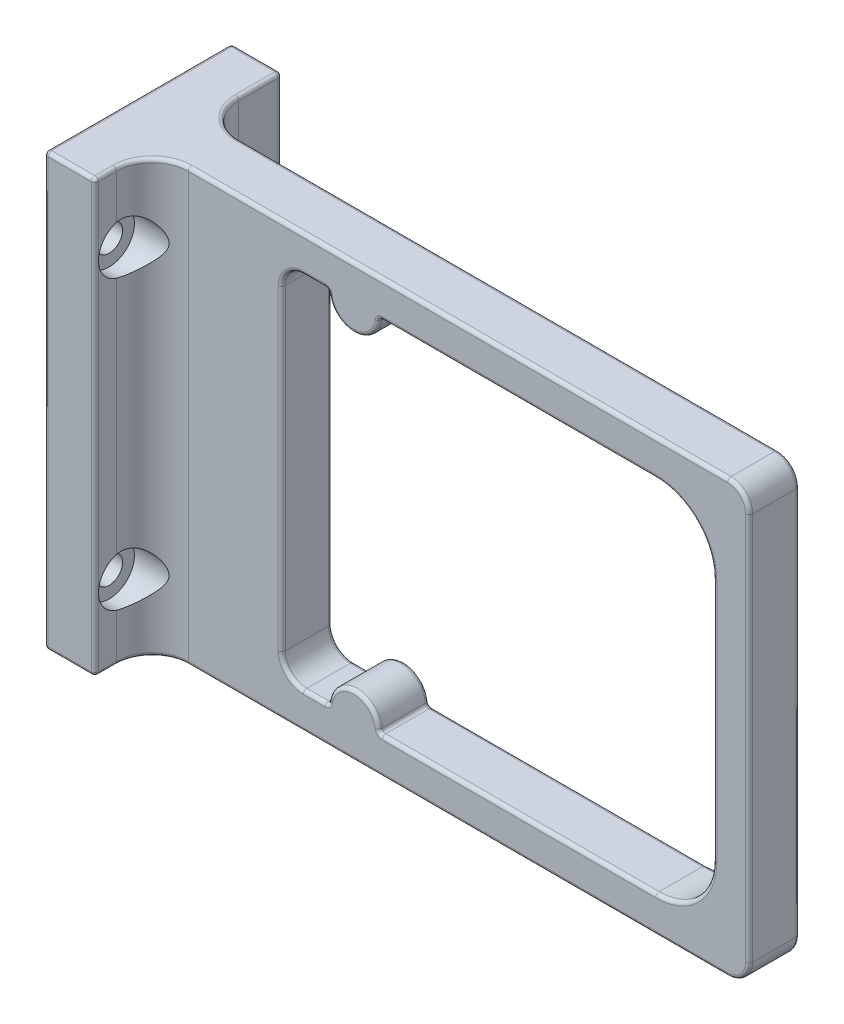
from build123d import *

# Parameters (mm, degrees)
BOSS_EXTRUDE1_DEPTH      = 7
BOSS_EXTRUDE2_DEPTH      = 8
BOSS_EXTRUDE2_DEPTH_BACK = 18
SKETCH2_W                = 7
SKETCH2_H                = 60
FILLET1_R                = 5
CUT_EXTRUDE1_DEPTH       = 10
CUT_EXTRUDE1_DEPTH_BACK  = 10
SKETCH3_R                = 1.85
CUT_EXTRUDE2_DEPTH       = 10
CUT_EXTRUDE2_DEPTH_BACK  = 2
SKETCH4_R                = 3.5
FILLET2_R                = 0.5
FILLET3_R                = 0.5
SKETCH5_R                = 1.75
CUT_EXTRUDE3_DEPTH       = 5


with BuildPart() as part:
    # Sketch1 → Boss-Extrude1 (new body)
    with BuildSketch(Plane.XY):
        with BuildLine():
            Line((-141, -31), (-54, -31))
            ThreePointArc((-54, -31), (-51.878679656, -30.121320344), (-51, -28))
            Line((-51, -28), (-51, 26))
            ThreePointArc((-51, 26), (-51.878679656, 28.121320344), (-54, 29))
            Line((-54, 29), (-141, 29))
            Line((-141, 29), (-141, -31))
        make_face()
        with BuildLine():
            Line((-113, 24), (-109.5, 24))
            ThreePointArc((-109.5, 24), (-106, 20.5), (-102.5, 24))
            Line((-102.5, 24), (-64, 24))
            ThreePointArc((-64, 24), (-58.343145751, 21.65685425), (-56, 16))
            Line((-56, 16), (-56, -18))
            ThreePointArc((-56, -18), (-58.343145751, -23.656854249), (-64, -26))
            Line((-64, -26), (-102.5, -26))
            ThreePointArc((-102.5, -26), (-106, -22.5), (-109.5, -26))
            Line((-109.5, -26), (-113, -26))
            ThreePointArc((-113, -26), (-115.121320344, -25.121320344), (-116, -23))
            Line((-116, -23), (-116, 21))
            ThreePointArc((-116, 21), (-115.121320344, 23.121320344), (-113, 24))
        make_face(mode=Mode.SUBTRACT)
    extrude(amount=BOSS_EXTRUDE1_DEPTH)

    # Sketch2 → Boss-Extrude2 (add, two sides: drawn at the far end of the back side and taken through both)
    with BuildSketch(Plane.XY.offset(7).offset(-BOSS_EXTRUDE2_DEPTH_BACK)):
        with Locations((-137.5, -1)):
            Rectangle(SKETCH2_W, SKETCH2_H)
    extrude(amount=BOSS_EXTRUDE2_DEPTH + BOSS_EXTRUDE2_DEPTH_BACK)

    # Fillet1
    fillet1_edges = [part.edges().sort_by_distance(p)[0] for p in [
        (-134, -1, 0),
        (-134, -1, 7),
    ]]
    fillet(fillet1_edges, radius=FILLET1_R)

    # Sketch3 → Cut-Extrude1 (cut, two sides: drawn at the far end of the back side and taken through both)
    with BuildSketch(Plane(origin=(-134, 0, 0), x_dir=(0, 0, -1), z_dir=(1, 0, 0)).offset(-CUT_EXTRUDE1_DEPTH_BACK)):
        with Locations(Location((-11, 19, 0), (0, 0, 237.279556634))):
            Circle(SKETCH3_R)
        with Locations(Location((-11, -21, 0), (0, 0, 237.279556634))):
            Circle(SKETCH3_R)
    extrude(amount=CUT_EXTRUDE1_DEPTH + CUT_EXTRUDE1_DEPTH_BACK, mode=Mode.SUBTRACT)

    # Sketch4 → Cut-Extrude2 (cut, two sides: drawn at the far end of the back side and taken through both)
    with BuildSketch(Plane(origin=(-134, 0, 0), x_dir=(0, 0, -1), z_dir=(1, 0, 0)).offset(-CUT_EXTRUDE2_DEPTH_BACK)):
        with Locations((-11, -21)):
            Circle(SKETCH4_R)
        with Locations((-11, 19)):
            Circle(SKETCH4_R)
    extrude(amount=CUT_EXTRUDE2_DEPTH + CUT_EXTRUDE2_DEPTH_BACK, mode=Mode.SUBTRACT)

    # Fillet2
    fillet2_edges = [part.edges().sort_by_distance(p)[0] for p in [
        (-141, -31, 2),
        (-141, 29, 2),
        (-51.878679656, 28.121320344, 7),
        (-91.5, 29, 7),
        (-51.878679656, -30.121320344, 7),
        (-137.5, 29, -11),
        (-137.5, -31, -11),
        (-134, -31, -8),
        (-141, -1, -11),
        (-134, -1, -11),
        (-134, 29, -8),
        (-141, -1, 15),
        (-137.5, -31, 15),
        (-134, -1, 15),
        (-137.5, 29, 15),
        (-91.5, 29, 0),
        (-51.878679656, 28.121320344, 0),
        (-51, -1, 0),
        (-134, -31, 13.5),
        (-134, 29, 13.5),
        (-91.5, -31, 7),
        (-91.5, -31, 0),
        (-51.878679656, -30.121320344, 0),
        (-132.535533906, 29, 8.464466094),
        (-132.535533906, -31, 8.464466094),
        (-51, -1, 7),
        (-132.535533906, 29, -1.464466094),
        (-132.535533906, -31, -1.464466094),
    ]]
    fillet(fillet2_edges, radius=FILLET2_R - 0.0001)  # a hair under: the kernel refuses the full size

    # Fillet3
    fillet3_edges = [part.edges().sort_by_distance(p)[0] for p in [
        (-115.121320344, -25.121320344, 0),
        (-111.25, -26, 0),
        (-106, -22.5, 0),
        (-109.5, -26, 3.5),
        (-83.25, -26, 0),
        (-102.5, -26, 3.5),
        (-58.343145751, -23.656854249, 0),
        (-56, -1, 0),
        (-58.343145751, 21.65685425, 0),
        (-83.25, 24, 0),
        (-106, 20.5, 0),
        (-102.5, 24, 3.5),
        (-111.25, 24, 0),
        (-109.5, 24, 3.5),
        (-115.121320344, 23.121320344, 0),
        (-116, -1, 0),
        (-115.121320344, -25.121320344, 7),
        (-111.25, -26, 7),
        (-106, -22.5, 7),
        (-83.25, -26, 7),
        (-58.343145751, -23.656854249, 7),
        (-56, -1, 7),
        (-58.343145751, 21.65685425, 7),
        (-83.25, 24, 7),
        (-106, 20.5, 7),
        (-111.25, 24, 7),
        (-115.121320344, 23.121320344, 7),
        (-116, -1, 7),
    ]]
    fillet(fillet3_edges, radius=FILLET3_R)

    # Sketch5 → Cut-Extrude3 (cut)
    with BuildSketch(Plane(origin=(0, 0, 0), x_dir=(-1, 0, 0), z_dir=(0, 0, -1))):
        with Locations((106, -26)):
            Circle(SKETCH5_R)
        with Locations((56, -26)):
            Circle(SKETCH5_R)
        with Locations((56, 24)):
            Circle(SKETCH5_R)
        with Locations((106, 24)):
            Circle(SKETCH5_R)
    extrude(amount=-CUT_EXTRUDE3_DEPTH, mode=Mode.SUBTRACT)


solid = part.part
